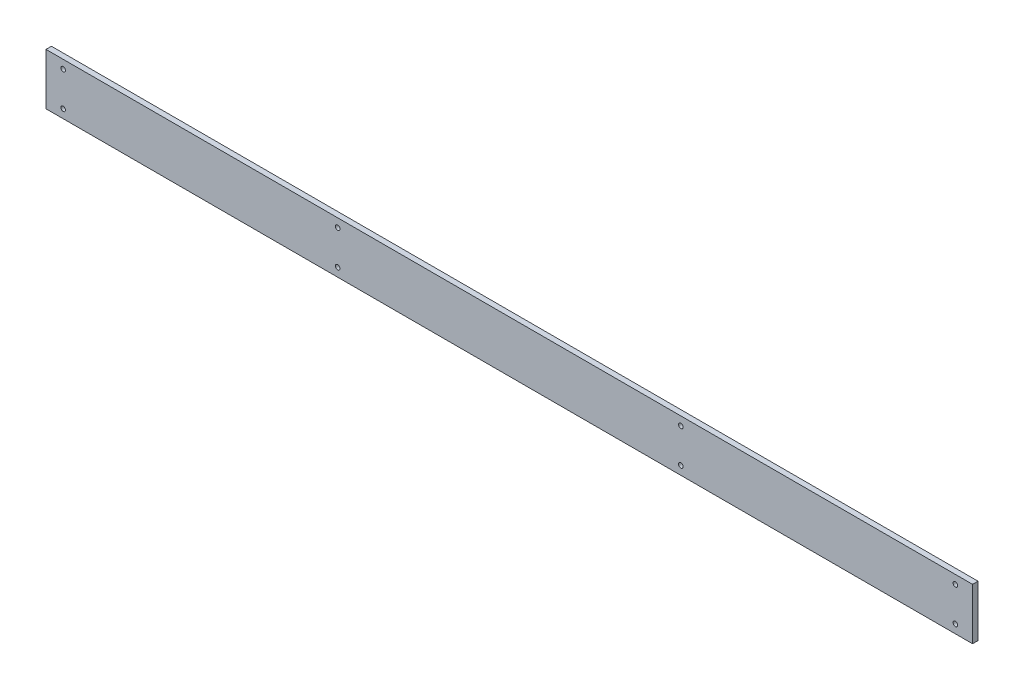
from build123d import *

# Parameters (mm, degrees)
SKETCH3_W               = 540
SKETCH3_H               = 30
BOSS_EXTRUDE3_DEPTH     = 3.18
CUT_EXTRUDE1_REACH      = 272.435
SKETCH4_R               = 1.35
MIRROR2_COPY_1_REACH    = 272.435
MIRROR2_COPY_1_SKETCH_R = 1.35
MIRROR2_COPY_2_REACH    = 272.435
MIRROR2_COPY_2_SKETCH_R = 1.35
CUT_EXTRUDE2_REACH      = 272.435
SKETCH5_R               = 1.35
MIRROR4_COPY_1_REACH    = 272.435
MIRROR4_COPY_1_SKETCH_R = 1.35


with BuildPart() as part:
    # Sketch3 → Boss-Extrude3 (new body)
    with BuildSketch(Plane.XY):
        Rectangle(SKETCH3_W, SKETCH3_H)
    extrude(amount=BOSS_EXTRUDE3_DEPTH)

    # Sketch4 → Cut-Extrude1 (cut, up to next)
    with BuildSketch(Plane.XY.offset(3.18), mode=Mode.PRIVATE) as cut_extrude1_sk1:
        with Locations((260, 10)):
            Circle(SKETCH4_R)
    cut_extrude1_tool1 = extrude(cut_extrude1_sk1.sketch, amount=-CUT_EXTRUDE1_REACH, mode=Mode.PRIVATE) & part.part
    cut_extrude1 = cut_extrude1_tool1.solids().sort_by_distance((260, 10, 3.18))[0]
    add(cut_extrude1, mode=Mode.SUBTRACT)

    # Mirror1: Cut-Extrude1 across plane
    add(cut_extrude1.mirror(Plane.ZX), mode=Mode.SUBTRACT)

    # Mirror2 copy 1 sketch → Mirror2 copy 1 (cut, up to next)
    with BuildSketch(Plane(origin=(0, 0, 3.18), x_dir=(-1, 0, 0), z_dir=(0, 0, 1)), mode=Mode.PRIVATE) as mirror2_copy_1_sk1:
        with Locations((260, 10)):
            Circle(MIRROR2_COPY_1_SKETCH_R)
    mirror2_copy_1_tool1 = extrude(mirror2_copy_1_sk1.sketch, amount=-MIRROR2_COPY_1_REACH, mode=Mode.PRIVATE) & part.part
    add(mirror2_copy_1_tool1.solids().sort_by_distance((-260, -10, 3.18))[0], mode=Mode.SUBTRACT)

    # Mirror2 copy 2 sketch → Mirror2 copy 2 (cut, up to next)
    with BuildSketch(Plane(origin=(0, 0, 3.18), x_dir=(-1, 0, 0), z_dir=(0, 0, 1)), mode=Mode.PRIVATE) as mirror2_copy_2_sk1:
        with Locations((260, -10)):
            Circle(MIRROR2_COPY_2_SKETCH_R)
    mirror2_copy_2_tool1 = extrude(mirror2_copy_2_sk1.sketch, amount=-MIRROR2_COPY_2_REACH, mode=Mode.PRIVATE) & part.part
    add(mirror2_copy_2_tool1.solids().sort_by_distance((-260, 10, 3.18))[0], mode=Mode.SUBTRACT)

    # Sketch5 → Cut-Extrude2 (cut, up to next)
    with BuildSketch(Plane.XY.offset(3.18), mode=Mode.PRIVATE) as cut_extrude2_sk1:
        with Locations((100, -10)):
            Circle(SKETCH5_R)
    cut_extrude2_tool1 = extrude(cut_extrude2_sk1.sketch, amount=-CUT_EXTRUDE2_REACH, mode=Mode.PRIVATE) & part.part
    cut_extrude2 = cut_extrude2_tool1.solids().sort_by_distance((100, -10, 3.18))[0]
    add(cut_extrude2, mode=Mode.SUBTRACT)

    # Mirror3: Cut-Extrude2 across plane
    add(cut_extrude2.mirror(Plane(origin=(0, 0, 0), x_dir=(0, 0, 1), z_dir=(1, 0, 0))), mode=Mode.SUBTRACT)

    # Mirror4: Cut-Extrude2 across plane
    add(cut_extrude2.mirror(Plane.ZX), mode=Mode.SUBTRACT)

    # Mirror4 copy 1 sketch → Mirror4 copy 1 (cut, up to next)
    with BuildSketch(Plane(origin=(0, 0, 3.18), x_dir=(-1, 0, 0), z_dir=(0, 0, 1)), mode=Mode.PRIVATE) as mirror4_copy_1_sk1:
        with Locations((100, -10)):
            Circle(MIRROR4_COPY_1_SKETCH_R)
    mirror4_copy_1_tool1 = extrude(mirror4_copy_1_sk1.sketch, amount=-MIRROR4_COPY_1_REACH, mode=Mode.PRIVATE) & part.part
    add(mirror4_copy_1_tool1.solids().sort_by_distance((-100, 10, 3.18))[0], mode=Mode.SUBTRACT)


solid = part.part
